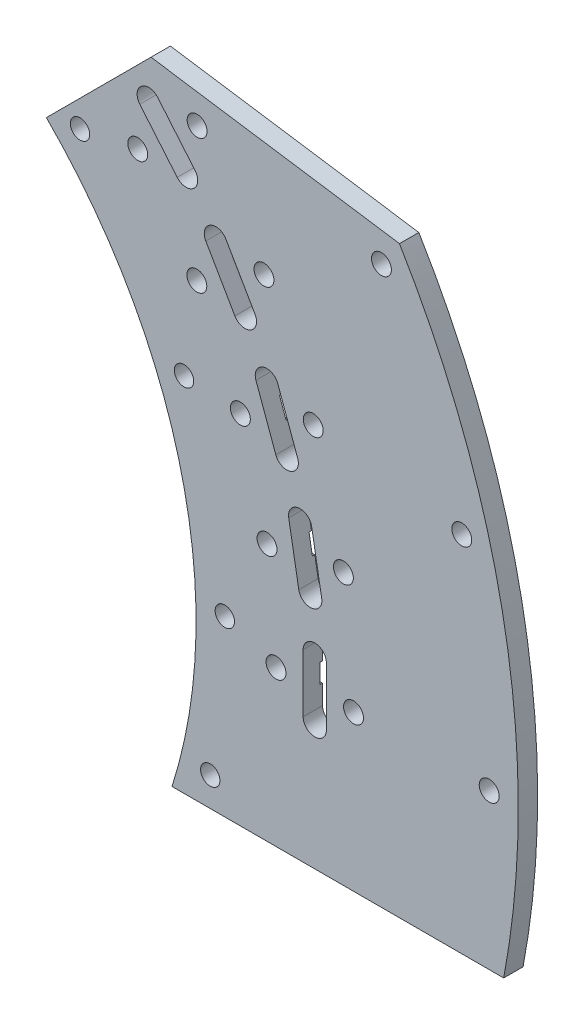
from build123d import *

# Parameters (mm, degrees)
SKETCH1_R           = 3.175
SKETCH1_R_2         = 3.2639
BOSS_EXTRUDE1_DEPTH = 6.35
SKETCH2_R           = 3.175
CUT_EXTRUDE1_DEPTH  = 0.79375


with BuildPart() as part:
    # Sketch1 → Boss-Extrude1 (new body)
    with BuildSketch(Plane.XY):
        with BuildLine():
            ThreePointArc((167.48125, 0), (165.496965553, -25.70454229), (159.591131024, -50.8))
            Line((159.591131024, -50.8), (268.282803213, -50.8))
            ThreePointArc((268.282803213, -50.8), (268.798556268, 47.996235774), (234.123018172, 140.508771477))
            Line((234.123018172, 140.508771477), (152.715190262, 152.715190262))
            Line((152.715190262, 152.715190262), (118.427127597, 118.427127597))
            ThreePointArc((118.427127597, 118.427127597), (154.732498954, 64.092299607), (167.48125, 0))
        make_face()
        with Locations((172.12665951, -41.275)):
            Circle(SKETCH1_R, mode=Mode.SUBTRACT)
        with Locations((193.675, 0)):
            Circle(SKETCH1_R_2, mode=Mode.SUBTRACT)
        with Locations((176.898422575, 6.177429038)):
            Circle(SKETCH1_R, mode=Mode.SUBTRACT)
        with Locations((190.732641565, 33.63131081)):
            Circle(SKETCH1_R_2, mode=Mode.SUBTRACT)
        with BuildLine():
            Line((202.565, -9.525), (202.565, 0))
            Line((202.565, 0), (202.565, 9.525))
            ThreePointArc((202.565, 9.525), (206.375, 13.335), (210.185, 9.525))
            Line((210.185, 9.525), (210.185, 0))
            Line((210.185, 0), (210.185, -9.525))
            ThreePointArc((210.185, -9.525), (206.375, -13.335), (202.565, -9.525))
        make_face(mode=Mode.SUBTRACT)
        with Locations((219.075, 0)):
            Circle(SKETCH1_R_2, mode=Mode.SUBTRACT)
        with Locations((263.525, 0)):
            Circle(SKETCH1_R_2, mode=Mode.SUBTRACT)
        with BuildLine():
            Line((201.141581381, 25.794749262), (199.487582489, 35.175043109))
            Line((199.487582489, 35.175043109), (197.833583597, 44.555336957))
            ThreePointArc((197.833583597, 44.555336957), (200.924101579, 48.969054052), (205.337818675, 45.87853607))
            Line((205.337818675, 45.87853607), (206.991817567, 36.498242223))
            Line((206.991817567, 36.498242223), (208.645816459, 27.117948375))
            ThreePointArc((208.645816459, 27.117948375), (205.555298477, 22.70423128), (201.141581381, 25.794749262))
        make_face(mode=Mode.SUBTRACT)
        with Locations((215.746758491, 38.041974522)):
            Circle(SKETCH1_R_2, mode=Mode.SUBTRACT)
        with Locations((163.532451502, 67.7373593)):
            Circle(SKETCH1_R, mode=Mode.SUBTRACT)
        with Locations((181.994968331, 66.240751259)):
            Circle(SKETCH1_R_2, mode=Mode.SUBTRACT)
        with BuildLine():
            Line((193.606577595, 60.33073812), (190.348835729, 69.281310333))
            Line((190.348835729, 69.281310333), (187.091093864, 78.231882546))
            ThreePointArc((187.091093864, 78.231882546), (189.368226003, 83.115208177), (194.251551635, 80.838076038))
            Line((194.251551635, 80.838076038), (197.5092935, 71.887503825))
            Line((197.5092935, 71.887503825), (200.767035365, 62.936931612))
            ThreePointArc((200.767035365, 62.936931612), (198.489903226, 58.053605981), (193.606577595, 60.33073812))
        make_face(mode=Mode.SUBTRACT)
        with Locations((167.727470078, 96.8375)):
            Circle(SKETCH1_R_2, mode=Mode.SUBTRACT)
        with Locations((129.454176147, 120.717972221)):
            Circle(SKETCH1_R, mode=Mode.SUBTRACT)
        with Locations((148.363657521, 124.491890306)):
            Circle(SKETCH1_R_2, mode=Mode.SUBTRACT)
        with BuildLine():
            Line((180.188935918, 93.033608029), (175.426435918, 101.2825))
            Line((175.426435918, 101.2825), (170.663935918, 109.531391971))
            ThreePointArc((170.663935918, 109.531391971), (172.058492706, 114.735948759), (177.263049494, 113.341391971))
            Line((177.263049494, 113.341391971), (182.025549494, 105.0925))
            Line((182.025549494, 105.0925), (186.788049494, 96.843608029))
            ThreePointArc((186.788049494, 96.843608029), (185.393492706, 91.639051241), (180.188935918, 93.033608029))
        make_face(mode=Mode.SUBTRACT)
        with Locations((189.724515334, 109.5375)):
            Circle(SKETCH1_R_2, mode=Mode.SUBTRACT)
        with BuildLine():
            Line((161.296344603, 122.909698835), (155.17379262, 130.206272156))
            Line((155.17379262, 130.206272156), (149.051240638, 137.502845477))
            ThreePointArc((149.051240638, 137.502845477), (149.520849174, 142.870495598), (154.888499295, 142.400887063))
            Line((154.888499295, 142.400887063), (161.011051277, 135.104313742))
            Line((161.011051277, 135.104313742), (167.133603259, 127.807740421))
            ThreePointArc((167.133603259, 127.807740421), (166.663994724, 122.4400903), (161.296344603, 122.909698835))
        make_face(mode=Mode.SUBTRACT)
        with Locations((167.821186376, 140.818695592)):
            Circle(SKETCH1_R_2, mode=Mode.SUBTRACT)
        with Locations((205.863160899, 74.928062899)):
            Circle(SKETCH1_R_2, mode=Mode.SUBTRACT)
        with Locations((254.545603373, 68.205288861)):
            Circle(SKETCH1_R_2, mode=Mode.SUBTRACT)
        with Locations((228.219344532, 131.7625)):
            Circle(SKETCH1_R_2, mode=Mode.SUBTRACT)
    extrude(amount=BOSS_EXTRUDE1_DEPTH)

    # Sketch2 → Cut-Extrude1 (cut)
    with BuildSketch(Plane.XY):
        with Locations((202.565, 0)):
            Circle(SKETCH2_R)
        with Locations((210.185, 0)):
            Circle(SKETCH2_R)
        with Locations((199.487582489, 35.175043109)):
            Circle(SKETCH2_R)
        with Locations((206.991817567, 36.498242223)):
            Circle(SKETCH2_R)
        with Locations((190.348835729, 69.281310333)):
            Circle(SKETCH2_R)
        with Locations((197.5092935, 71.887503825)):
            Circle(SKETCH2_R)
        with Locations((175.426435918, 101.2825)):
            Circle(SKETCH2_R)
        with Locations((182.025549494, 105.0925)):
            Circle(SKETCH2_R)
        with Locations((155.17379262, 130.206272156)):
            Circle(SKETCH2_R)
        with Locations((161.011051277, 135.104313742)):
            Circle(SKETCH2_R)
    extrude(amount=CUT_EXTRUDE1_DEPTH, mode=Mode.SUBTRACT)


solid = part.part
